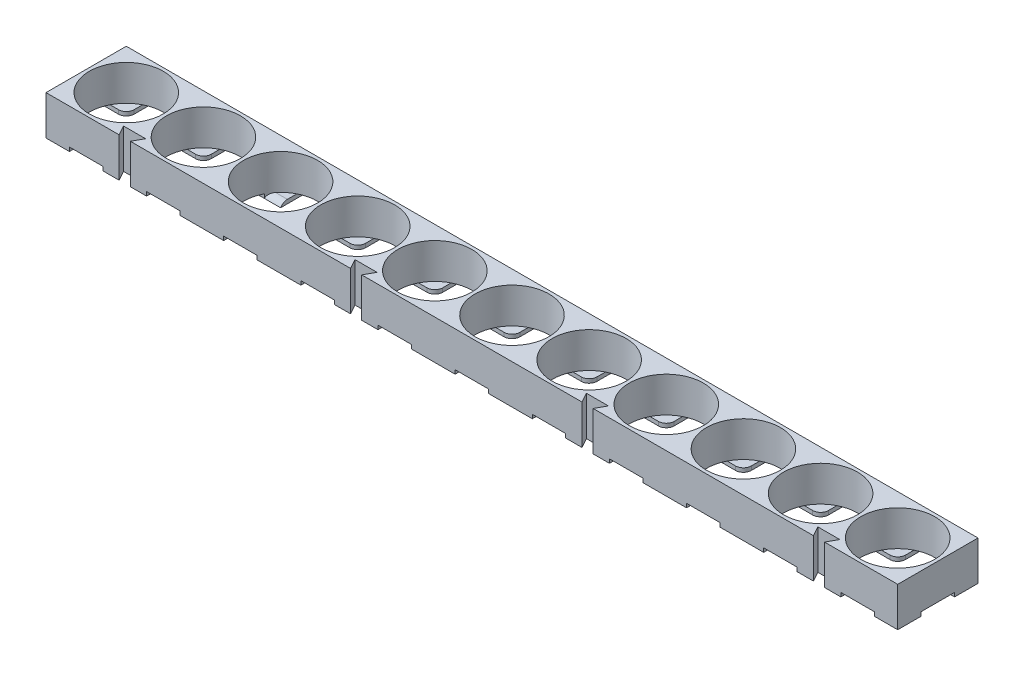
from build123d import *

# Parameters (mm, degrees)
SKETCH3_R           = 9.4
BOSS_EXTRUDE3_DEPTH = 10
SKETCH3_4_R         = 9.4
BOSS_EXTRUDE6_DEPTH = 1
SKETCH8_W           = 216.4
SKETCH8_H           = 8.5
SKETCH8_W_2         = 8.5
SKETCH8_H_2         = 20.4
CUT_EXTRUDE4_DEPTH  = 207.76846955
FILLET3_R           = 2
SKETCH9_W           = 218.084909882
SKETCH9_H           = 5.062401282
CUT_EXTRUDE5_DEPTH  = 207.814409561


with BuildPart() as part:
    # Sketch3 → Boss-Extrude3 (new body)
    # profile 1 of 5: a face of its own
    with BuildSketch(Plane(origin=(0, 0, 0), x_dir=(1, 0, 0), z_dir=(0, 1, 0))):
        Polygon((8.570170592, 10.2), (-10.2, 10.2), (-10.2, -10.2), (8.385772629, -10.2), (7, -7.7), (12.6, -7.7), (11.214227371, -10.2), (67.185772629, -10.2), (65.8, -7.7), (71.4, -7.7), (70.014227371, -10.2), (125.985772629, -10.2), (124.6, -7.7), (130.2, -7.7), (128.814227371, -10.2), (184.785772629, -10.2), (183.4, -7.7), (189, -7.7), (187.614227371, -10.2), (206.2, -10.2), (206.2, 10.2), (187.429829408, 10.2), (184.970170592, 10.2), (128.629829408, 10.2), (126.170170592, 10.2), (69.829829408, 10.2), (67.370170592, 10.2), (11.029829408, 10.2), align=None)
        with Locations(Location((0, 0, 0), (0, 0, 270))):
            Circle(SKETCH3_R, mode=Mode.SUBTRACT)
        with Locations(Location((19.6, 0, 0), (0, 0, 270))):
            Circle(SKETCH3_R, mode=Mode.SUBTRACT)
        with Locations(Location((39.2, 0, 0), (0, 0, 270))):
            Circle(SKETCH3_R, mode=Mode.SUBTRACT)
        with Locations(Location((58.8, 0, 0), (0, 0, 270))):
            Circle(SKETCH3_R, mode=Mode.SUBTRACT)
        with Locations(Location((78.4, 0, 0), (0, 0, 270))):
            Circle(SKETCH3_R, mode=Mode.SUBTRACT)
        with Locations(Location((98, 0, 0), (0, 0, 270))):
            Circle(SKETCH3_R, mode=Mode.SUBTRACT)
        with Locations(Location((117.6, 0, 0), (0, 0, 270))):
            Circle(SKETCH3_R, mode=Mode.SUBTRACT)
        with Locations(Location((137.2, 0, 0), (0, 0, 270))):
            Circle(SKETCH3_R, mode=Mode.SUBTRACT)
        with Locations(Location((156.8, 0, 0), (0, 0, 270))):
            Circle(SKETCH3_R, mode=Mode.SUBTRACT)
        with Locations(Location((176.4, 0, 0), (0, 0, 270))):
            Circle(SKETCH3_R, mode=Mode.SUBTRACT)
        with Locations(Location((196, 0, 0), (0, 0, 270))):
            Circle(SKETCH3_R, mode=Mode.SUBTRACT)
    # profile 2 of 5: a face of its own
    with BuildSketch(Plane(origin=(0, 0, 0), x_dir=(1, 0, 0), z_dir=(0, 1, 0))):
        Polygon((7.3, 12.4), (8.570170592, 10.2), (11.029829408, 10.2), (12.3, 12.4), align=None)
    # profile 3 of 5: a face of its own
    with BuildSketch(Plane(origin=(0, 0, 0), x_dir=(1, 0, 0), z_dir=(0, 1, 0))):
        Polygon((66.1, 12.4), (67.370170592, 10.2), (69.829829408, 10.2), (71.1, 12.4), align=None)
    # profile 4 of 5: a face of its own
    with BuildSketch(Plane(origin=(0, 0, 0), x_dir=(1, 0, 0), z_dir=(0, 1, 0))):
        Polygon((124.9, 12.4), (126.170170592, 10.2), (128.629829408, 10.2), (129.9, 12.4), align=None)
    # profile 5 of 5: a face of its own
    with BuildSketch(Plane(origin=(0, 0, 0), x_dir=(1, 0, 0), z_dir=(0, 1, 0))):
        Polygon((183.7, 12.4), (184.970170592, 10.2), (187.429829408, 10.2), (188.7, 12.4), align=None)
    extrude(amount=BOSS_EXTRUDE3_DEPTH)

    # Sketch3<4> → Boss-Extrude6 (add)
    with BuildSketch(Plane(origin=(0, 0, 0), x_dir=(1, 0, 0), z_dir=(0, 1, 0))):
        with Locations(Location((0, 0, 0), (0, 0, 270))):
            Circle(SKETCH3_4_R)
        with Locations(Location((19.6, 0, 0), (0, 0, 270))):
            Circle(SKETCH3_4_R)
        with Locations(Location((39.2, 0, 0), (0, 0, 270))):
            Circle(SKETCH3_4_R)
        with Locations(Location((58.8, 0, 0), (0, 0, 270))):
            Circle(SKETCH3_4_R)
        with Locations(Location((78.4, 0, 0), (0, 0, 270))):
            Circle(SKETCH3_4_R)
        with Locations(Location((98, 0, 0), (0, 0, 270))):
            Circle(SKETCH3_4_R)
        with Locations(Location((117.6, 0, 0), (0, 0, 270))):
            Circle(SKETCH3_4_R)
        with Locations(Location((137.2, 0, 0), (0, 0, 270))):
            Circle(SKETCH3_4_R)
        with Locations(Location((156.8, 0, 0), (0, 0, 270))):
            Circle(SKETCH3_4_R)
        with Locations(Location((176.4, 0, 0), (0, 0, 270))):
            Circle(SKETCH3_4_R)
        with Locations(Location((196, 0, 0), (0, 0, 270))):
            Circle(SKETCH3_4_R)
    extrude(amount=BOSS_EXTRUDE6_DEPTH)

    # Sketch8 → Cut-Extrude4 (cut, through all)
    with BuildSketch(Plane(origin=(0, 1, 0), x_dir=(1, 0, 0), z_dir=(0, 1, 0))):
        with Locations((98, 0)):
            Rectangle(SKETCH8_W, SKETCH8_H)
        Rectangle(SKETCH8_W_2, SKETCH8_H_2)
        with Locations((19.6, 0)):
            Rectangle(SKETCH8_W_2, SKETCH8_H_2)
        with Locations((39.2, 0)):
            Rectangle(SKETCH8_W_2, SKETCH8_H_2)
        with Locations((58.8, 0)):
            Rectangle(SKETCH8_W_2, SKETCH8_H_2)
        with Locations((78.4, 0)):
            Rectangle(SKETCH8_W_2, SKETCH8_H_2)
        with Locations((98, 0)):
            Rectangle(SKETCH8_W_2, SKETCH8_H_2)
        with Locations((117.6, 0)):
            Rectangle(SKETCH8_W_2, SKETCH8_H_2)
        with Locations((137.2, 0)):
            Rectangle(SKETCH8_W_2, SKETCH8_H_2)
        with Locations((156.8, 0)):
            Rectangle(SKETCH8_W_2, SKETCH8_H_2)
        with Locations((176.4, 0)):
            Rectangle(SKETCH8_W_2, SKETCH8_H_2)
        with Locations((196, 0)):
            Rectangle(SKETCH8_W_2, SKETCH8_H_2)
    extrude(amount=-CUT_EXTRUDE4_DEPTH, mode=Mode.SUBTRACT)

    # Fillet3
    # the kernel refuses this fillet: 2 mm, written as the material it takes off along each edge
    with BuildSketch(Plane(origin=(4.25, 6, -4.25), x_dir=(0, 0, -1), z_dir=(0, -1, 0)), Plane(origin=(-4.25, -5, -4.25), x_dir=(0, 0, -1), z_dir=(0, 1, 0)), Plane(origin=(4.25, -5, 4.25), x_dir=(0, 0, 1), z_dir=(0, 1, 0)), Plane(origin=(200.25, -5, -4.25), x_dir=(1, 0, 0), z_dir=(0, 1, 0))) as fillet3_piece_1:
        with BuildLine():
            CenterArc((FILLET3_R, FILLET3_R), FILLET3_R, 180, 90)
            Line((0, FILLET3_R), (0, 0))
            Line((0, 0), (FILLET3_R, 0))
        make_face()
    extrude(amount=11, mode=Mode.SUBTRACT)
    with BuildSketch(Plane(origin=(-4.25, 6, 4.25), x_dir=(-1, 0, 0), z_dir=(0, -1, 0)), Plane(origin=(191.75, 6, -4.25), x_dir=(0, 0, -1), z_dir=(0, -1, 0)), Plane(origin=(191.75, -5, 4.25), x_dir=(0, 0, 1), z_dir=(0, 1, 0)), Plane(origin=(172.15, 6, -4.25), x_dir=(0, 0, -1), z_dir=(0, -1, 0)), Plane(origin=(172.15, -5, 4.25), x_dir=(0, 0, 1), z_dir=(0, 1, 0)), Plane(origin=(152.55, -5, 4.25), x_dir=(0, 0, 1), z_dir=(0, 1, 0)), Plane(origin=(152.55, 6, -4.25), x_dir=(0, 0, -1), z_dir=(0, -1, 0)), Plane(origin=(132.95, 6, -4.25), x_dir=(0, 0, -1), z_dir=(0, -1, 0)), Plane(origin=(132.95, -5, 4.25), x_dir=(0, 0, 1), z_dir=(0, 1, 0)), Plane(origin=(113.35, 6, -4.25), x_dir=(0, 0, -1), z_dir=(0, -1, 0)), Plane(origin=(93.75, -5, 4.25), x_dir=(0, 0, 1), z_dir=(0, 1, 0)), Plane(origin=(93.75, 6, -4.25), x_dir=(0, 0, -1), z_dir=(0, -1, 0)), Plane(origin=(74.15, -5, 4.25), x_dir=(0, 0, 1), z_dir=(0, 1, 0)), Plane(origin=(74.15, 6, -4.25), x_dir=(0, 0, -1), z_dir=(0, -1, 0)), Plane(origin=(54.55, 6, -4.25), x_dir=(0, 0, -1), z_dir=(0, -1, 0)), Plane(origin=(54.55, -5, 4.25), x_dir=(0, 0, 1), z_dir=(0, 1, 0)), Plane(origin=(34.95, -5, 4.25), x_dir=(0, 0, 1), z_dir=(0, 1, 0)), Plane(origin=(63.05, -5, -4.25), x_dir=(0, 0, -1), z_dir=(0, 1, 0)), Plane(origin=(63.05, 6, 4.25), x_dir=(0, 0, 1), z_dir=(0, -1, 0)), Plane(origin=(82.65, -5, -4.25), x_dir=(0, 0, -1), z_dir=(0, 1, 0)), Plane(origin=(82.65, 6, 4.25), x_dir=(0, 0, 1), z_dir=(0, -1, 0)), Plane(origin=(102.25, -5, -4.25), x_dir=(0, 0, -1), z_dir=(0, 1, 0)), Plane(origin=(102.25, 6, 4.25), x_dir=(0, 0, 1), z_dir=(0, -1, 0)), Plane(origin=(121.85, -5, -4.25), x_dir=(0, 0, -1), z_dir=(0, 1, 0)), Plane(origin=(121.85, 6, 4.25), x_dir=(0, 0, 1), z_dir=(0, -1, 0)), Plane(origin=(141.45, 6, 4.25), x_dir=(0, 0, 1), z_dir=(0, -1, 0)), Plane(origin=(141.45, -5, -4.25), x_dir=(0, 0, -1), z_dir=(0, 1, 0)), Plane(origin=(161.05, -5, -4.25), x_dir=(0, 0, -1), z_dir=(0, 1, 0)), Plane(origin=(161.05, 6, 4.25), x_dir=(0, 0, 1), z_dir=(0, -1, 0)), Plane(origin=(180.65, 6, 4.25), x_dir=(0, 0, 1), z_dir=(0, -1, 0)), Plane(origin=(180.65, -5, -4.25), x_dir=(0, 0, -1), z_dir=(0, 1, 0)), Plane(origin=(200.25, 6, 4.25), x_dir=(0, 0, 1), z_dir=(0, -1, 0)), Plane(origin=(43.45, 6, 4.25), x_dir=(0, 0, 1), z_dir=(0, -1, 0)), Plane(origin=(43.45, -5, -4.25), x_dir=(0, 0, -1), z_dir=(0, 1, 0)), Plane(origin=(23.85, -5, -4.25), x_dir=(0, 0, -1), z_dir=(0, 1, 0)), Plane(origin=(23.85, 6, 4.25), x_dir=(0, 0, 1), z_dir=(0, -1, 0)), Plane(origin=(15.35, -5, 4.25), x_dir=(0, 0, 1), z_dir=(0, 1, 0)), Plane(origin=(15.35, 6, -4.25), x_dir=(0, 0, -1), z_dir=(0, -1, 0))) as fillet3_piece_2:
        with BuildLine():
            CenterArc((FILLET3_R, -FILLET3_R), FILLET3_R, 90, 90)
            Line((0, -FILLET3_R), (0, 0))
            Line((0, 0), (FILLET3_R, 0))
        make_face()
    extrude(amount=11, mode=Mode.SUBTRACT)
    with BuildSketch(Plane(origin=(104.88551254, 1, 4.25), x_dir=(0, 0, 1), z_dir=(1, 0, 0))) as fillet3_piece_3_section:
        with BuildLine():
            CenterArc((1.732050808, 2), FILLET3_R, 210, 60)
            Line((0, 1), (0, 0))
            Line((0, 0), (1.732050808, 0))
        make_face()
    fillet3_piece_3 = extrude(amount=12.794614479, mode=Mode.PRIVATE)
    fillet3_piece_3 = fillet3_piece_3 & Plane(origin=(117.6, 1, 0), x_dir=(0, 0, 1), z_dir=(0, -1, 0)) * Cylinder(9.4, 33, mode=Mode.PRIVATE)
    add(fillet3_piece_3, mode=Mode.SUBTRACT)
    with BuildSketch(Plane(origin=(39.280127019, 1, -4.25), x_dir=(0, 0, -1), z_dir=(-1, 0, 0))) as fillet3_piece_4_section:
        with BuildLine():
            CenterArc((1.732050808, 2), FILLET3_R, 210, 60)
            Line((0, 1), (0, 0))
            Line((0, 0), (1.732050808, 0))
        make_face()
    fillet3_piece_4 = extrude(amount=12.794614479, mode=Mode.PRIVATE)
    fillet3_piece_4 = fillet3_piece_4 & Plane(origin=(39.2, 1, 0), x_dir=(0, 0, 1), z_dir=(0, -1, 0)) * Cylinder(9.4, 33, mode=Mode.PRIVATE)
    add(fillet3_piece_4, mode=Mode.SUBTRACT)

    # Sketch9 → Cut-Extrude5 (cut, through all)
    with BuildSketch(Plane(origin=(0, 10, 0), x_dir=(1, 0, 0), z_dir=(0, 1, 0))):
        with Locations((98.842454941, 12.731200641)):
            Rectangle(SKETCH9_W, SKETCH9_H)
    extrude(amount=-CUT_EXTRUDE5_DEPTH, mode=Mode.SUBTRACT)


solid = part.part
